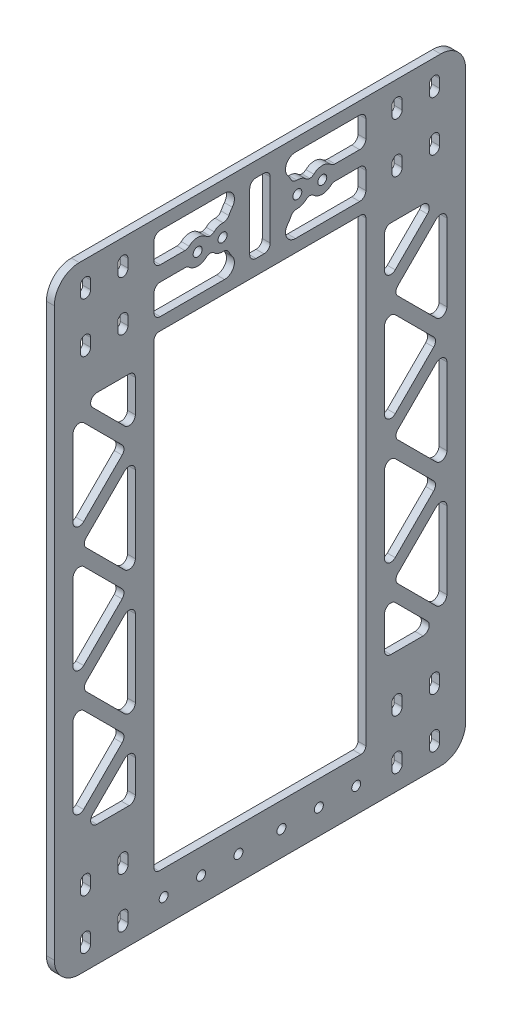
from build123d import *

# Parameters (mm, degrees)
BASE_FLANGE1_START         = -3.175
BASE_FLANGE1_OUTLINE_W     = 247.4
BASE_FLANGE1_OUTLINE_H     = 165
BASE_FLANGE1_OUTLINE_R     = 2.05
BASE_FLANGE1_OUTLINE_W_2   = 28
BASE_FLANGE1_OUTLINE_H_2   = 8.2
BASE_FLANGE1_DEPTH         = 3.175
FILLET1_R                  = 10
SLOTTED_CUTOUTS_DEPTH      = 149.721285044
SLOTTED_CUTOUTS_DEPTH_BACK = 149.721285044
SKETCH4_W                  = 85
SKETCH4_H                  = 187.4
CUT_EXTRUDE3_DEPTH         = 149.721285044
FILLET4_R                  = 2
FILLET3_R                  = 2.5
M3_CLEARANCE_HOLE1_D       = 3.6
FILLET8_R                  = 2.5


# Read off the part's stored shape, not the designer's step: Base-Flange1
with BuildPart() as part:
    # Base-Flange1 outline → Base-Flange1 (new body)
    with BuildSketch(Plane.YZ.offset(BASE_FLANGE1_START)):
        Rectangle(BASE_FLANGE1_OUTLINE_W, BASE_FLANGE1_OUTLINE_H)
        with Locations((-113.7, -70)):
            Circle(BASE_FLANGE1_OUTLINE_R, mode=Mode.SUBTRACT)
        with Locations((-93.7, -70)):
            Circle(BASE_FLANGE1_OUTLINE_R, mode=Mode.SUBTRACT)
        with Locations((-113.7, -55)):
            Circle(BASE_FLANGE1_OUTLINE_R, mode=Mode.SUBTRACT)
        with Locations((-93.7, -55)):
            Circle(BASE_FLANGE1_OUTLINE_R, mode=Mode.SUBTRACT)
        with Locations((93.7, -70)):
            Circle(BASE_FLANGE1_OUTLINE_R, mode=Mode.SUBTRACT)
        with Locations((113.7, -70)):
            Circle(BASE_FLANGE1_OUTLINE_R, mode=Mode.SUBTRACT)
        with Locations((93.7, -55)):
            Circle(BASE_FLANGE1_OUTLINE_R, mode=Mode.SUBTRACT)
        with Locations((113.7, -55)):
            Circle(BASE_FLANGE1_OUTLINE_R, mode=Mode.SUBTRACT)
        with Locations((-113.7, 55)):
            Circle(BASE_FLANGE1_OUTLINE_R, mode=Mode.SUBTRACT)
        with Locations((-93.7, 55)):
            Circle(BASE_FLANGE1_OUTLINE_R, mode=Mode.SUBTRACT)
        with Locations((-113.7, 70)):
            Circle(BASE_FLANGE1_OUTLINE_R, mode=Mode.SUBTRACT)
        with Locations((-93.7, 70)):
            Circle(BASE_FLANGE1_OUTLINE_R, mode=Mode.SUBTRACT)
        with Locations((103.7, 0)):
            Rectangle(BASE_FLANGE1_OUTLINE_W_2, BASE_FLANGE1_OUTLINE_H_2, mode=Mode.SUBTRACT)
        with Locations((93.7, 55)):
            Circle(BASE_FLANGE1_OUTLINE_R, mode=Mode.SUBTRACT)
        with Locations((113.7, 55)):
            Circle(BASE_FLANGE1_OUTLINE_R, mode=Mode.SUBTRACT)
        with Locations((93.7, 70)):
            Circle(BASE_FLANGE1_OUTLINE_R, mode=Mode.SUBTRACT)
        with Locations((113.7, 70)):
            Circle(BASE_FLANGE1_OUTLINE_R, mode=Mode.SUBTRACT)
    extrude(amount=BASE_FLANGE1_DEPTH)

    # Fillet1
    fillet1_edges = [part.edges().sort_by_distance(p)[0] for p in [
        (-1.5875, -123.7, -82.5),
        (-1.5875, -123.7, 82.5),
        (-1.5875, 123.7, 82.5),
        (-1.5875, 123.7, -82.5),
    ]]
    fillet(fillet1_edges, radius=FILLET1_R)

    # Sketch5 → Slotted Cutouts (cut, two sides: drawn at the far end of the back side and taken through both)
    with BuildSketch(Plane(origin=(0, 0, 0), x_dir=(0, 0, -1), z_dir=(1, 0, 0)).offset(-SLOTTED_CUTOUTS_DEPTH_BACK)):
        with BuildLine():
            Line((-72.05, 112), (-72.05, 115.4))
            ThreePointArc((-72.05, 115.4), (-70, 117.45), (-67.95, 115.4))
            Line((-67.95, 115.4), (-67.95, 112))
            ThreePointArc((-67.95, 112), (-70, 109.95), (-72.05, 112))
        make_face()
        with BuildLine():
            Line((-52.95, 112), (-52.95, 115.4))
            ThreePointArc((-52.95, 115.4), (-55, 117.45), (-57.05, 115.4))
            Line((-57.05, 115.4), (-57.05, 112))
            ThreePointArc((-57.05, 112), (-55, 109.95), (-52.95, 112))
        make_face()
        with BuildLine():
            Line((-72.05, 95.4), (-72.05, 92))
            ThreePointArc((-72.05, 92), (-70, 89.95), (-67.95, 92))
            Line((-67.95, 92), (-67.95, 95.4))
            ThreePointArc((-67.95, 95.4), (-70, 97.45), (-72.05, 95.4))
        make_face()
        with BuildLine():
            Line((-52.95, 95.4), (-52.95, 92))
            ThreePointArc((-52.95, 92), (-55, 89.95), (-57.05, 92))
            Line((-57.05, 92), (-57.05, 95.4))
            ThreePointArc((-57.05, 95.4), (-55, 97.45), (-52.95, 95.4))
        make_face()
        with BuildLine():
            Line((72.05, 112), (72.05, 115.4))
            ThreePointArc((72.05, 115.4), (70, 117.45), (67.95, 115.4))
            Line((67.95, 115.4), (67.95, 112))
            ThreePointArc((67.95, 112), (70, 109.95), (72.05, 112))
        make_face()
        with BuildLine():
            Line((52.95, 112), (52.95, 115.4))
            ThreePointArc((52.95, 115.4), (55, 117.45), (57.05, 115.4))
            Line((57.05, 115.4), (57.05, 112))
            ThreePointArc((57.05, 112), (55, 109.95), (52.95, 112))
        make_face()
        with BuildLine():
            Line((72.05, 95.4), (72.05, 92))
            ThreePointArc((72.05, 92), (70, 89.95), (67.95, 92))
            Line((67.95, 92), (67.95, 95.4))
            ThreePointArc((67.95, 95.4), (70, 97.45), (72.05, 95.4))
        make_face()
        with BuildLine():
            Line((52.95, 95.4), (52.95, 92))
            ThreePointArc((52.95, 92), (55, 89.95), (57.05, 92))
            Line((57.05, 92), (57.05, 95.4))
            ThreePointArc((57.05, 95.4), (55, 97.45), (52.95, 95.4))
        make_face()
        with BuildLine():
            Line((-72.05, -112), (-72.05, -115.4))
            ThreePointArc((-72.05, -115.4), (-70, -117.45), (-67.95, -115.4))
            Line((-67.95, -115.4), (-67.95, -112))
            ThreePointArc((-67.95, -112), (-70, -109.95), (-72.05, -112))
        make_face()
        with BuildLine():
            Line((-52.95, -112), (-52.95, -115.4))
            ThreePointArc((-52.95, -115.4), (-55, -117.45), (-57.05, -115.4))
            Line((-57.05, -115.4), (-57.05, -112))
            ThreePointArc((-57.05, -112), (-55, -109.95), (-52.95, -112))
        make_face()
        with BuildLine():
            Line((-72.05, -95.4), (-72.05, -92))
            ThreePointArc((-72.05, -92), (-70, -89.95), (-67.95, -92))
            Line((-67.95, -92), (-67.95, -95.4))
            ThreePointArc((-67.95, -95.4), (-70, -97.45), (-72.05, -95.4))
        make_face()
        with BuildLine():
            Line((-52.95, -95.4), (-52.95, -92))
            ThreePointArc((-52.95, -92), (-55, -89.95), (-57.05, -92))
            Line((-57.05, -92), (-57.05, -95.4))
            ThreePointArc((-57.05, -95.4), (-55, -97.45), (-52.95, -95.4))
        make_face()
        with BuildLine():
            Line((52.95, -112), (52.95, -115.4))
            ThreePointArc((52.95, -115.4), (55, -117.45), (57.05, -115.4))
            Line((57.05, -115.4), (57.05, -112))
            ThreePointArc((57.05, -112), (55, -109.95), (52.95, -112))
        make_face()
        with BuildLine():
            Line((72.05, -112), (72.05, -115.4))
            ThreePointArc((72.05, -115.4), (70, -117.45), (67.95, -115.4))
            Line((67.95, -115.4), (67.95, -112))
            ThreePointArc((67.95, -112), (70, -109.95), (72.05, -112))
        make_face()
        with BuildLine():
            Line((52.95, -95.4), (52.95, -92))
            ThreePointArc((52.95, -92), (55, -89.95), (57.05, -92))
            Line((57.05, -92), (57.05, -95.4))
            ThreePointArc((57.05, -95.4), (55, -97.45), (52.95, -95.4))
        make_face()
        with BuildLine():
            Line((72.05, -95.4), (72.05, -92))
            ThreePointArc((72.05, -92), (70, -89.95), (67.95, -92))
            Line((67.95, -92), (67.95, -95.4))
            ThreePointArc((67.95, -95.4), (70, -97.45), (72.05, -95.4))
        make_face()
    extrude(amount=SLOTTED_CUTOUTS_DEPTH + SLOTTED_CUTOUTS_DEPTH_BACK, mode=Mode.SUBTRACT)

    # Sketch4 → Cut-Extrude3 (cut, through all)
    with BuildSketch(Plane(origin=(0, 0, 0), x_dir=(0, 0, -1), z_dir=(1, 0, 0))):
        with BuildLine():
            ThreePointArc((14.247806849, 118.7), (10.657696977, 116.463834207), (11.081627549, 112.255555556))
            ThreePointArc((11.081627549, 112.255555556), (12.295687401, 110.394480662), (13.2, 108.364761516))
            ThreePointArc((13.2, 108.364761516), (16.379441092, 108.505948634), (19, 106.7))
            Line((19, 106.7), (21, 106.7))
            ThreePointArc((21, 106.7), (25, 108.7), (29, 106.7))
            Line((29, 106.7), (42.5, 106.7))
            Line((42.5, 106.7), (42.5, 118.7))
            Line((42.5, 118.7), (14.247806849, 118.7))
        make_face()
        with BuildLine():
            ThreePointArc((-13.2, 108.364761516), (-12.295687401, 110.394480662), (-11.081627549, 112.255555556))
            ThreePointArc((-11.081627549, 112.255555556), (-10.657696977, 116.463834207), (-14.247806849, 118.7))
            Line((-14.247806849, 118.7), (-42.5, 118.7))
            Line((-42.5, 118.7), (-42.5, 106.7))
            Line((-42.5, 106.7), (-29, 106.7))
            ThreePointArc((-29, 106.7), (-25, 108.7), (-21, 106.7))
            Line((-21, 106.7), (-19, 106.7))
            ThreePointArc((-19, 106.7), (-16.379441092, 108.505948634), (-13.2, 108.364761516))
        make_face()
        with BuildLine():
            ThreePointArc((-14.247806849, 88.7), (-10.657696977, 90.936165793), (-11.081627549, 95.144444444))
            ThreePointArc((-11.081627549, 95.144444444), (-12.295687401, 97.005519338), (-13.2, 99.035238484))
            ThreePointArc((-13.2, 99.035238484), (-16.379441092, 98.894051366), (-19, 100.7))
            Line((-19, 100.7), (-21, 100.7))
            ThreePointArc((-21, 100.7), (-25, 98.7), (-29, 100.7))
            Line((-29, 100.7), (-42.5, 100.7))
            Line((-42.5, 100.7), (-42.5, 88.7))
            Line((-42.5, 88.7), (-14.247806849, 88.7))
        make_face()
        with BuildLine():
            ThreePointArc((13.2, 99.035238484), (12.295687401, 97.005519338), (11.081627549, 95.144444444))
            ThreePointArc((11.081627549, 95.144444444), (10.657696977, 90.936165793), (14.247806849, 88.7))
            Line((14.247806849, 88.7), (42.5, 88.7))
            Line((42.5, 88.7), (42.5, 100.7))
            Line((42.5, 100.7), (29, 100.7))
            ThreePointArc((29, 100.7), (25, 98.7), (21, 100.7))
            Line((21, 100.7), (19, 100.7))
            ThreePointArc((19, 100.7), (16.379441092, 98.894051366), (13.2, 99.035238484))
        make_face()
        with Locations((0, -10)):
            Rectangle(SKETCH4_W, SKETCH4_H)
        Polygon((-75, -28.535533906), (-75, -71.464466094), (-53.535533906, -50), align=None)
        Polygon((-50, -53.535533906), (-71.464466094, -75), (-50, -75), align=None)
        Polygon((-71.464466094, -25), (-50, -46.464466094), (-50, -3.535533906), align=None)
        Polygon((-75, 21.464466094), (-75, -21.464466094), (-53.535533906, 0), align=None)
        Polygon((-71.464466094, 25), (-50, 3.535533906), (-50, 46.464466094), align=None)
        Polygon((-75, 71.464466094), (-75, 28.535533906), (-53.535533906, 50), align=None)
        Polygon((-71.464466094, 75), (-50, 53.535533906), (-50, 75), align=None)
        Polygon((75, 71.464466094), (53.535533906, 50), (75, 28.535533906), align=None)
        Polygon((50, 53.535533906), (71.464466094, 75), (50, 75), align=None)
        Polygon((75, -21.464466094), (75, 21.464466094), (53.535533906, 0), align=None)
        Polygon((71.464466094, 25), (50, 46.464466094), (50, 3.535533906), align=None)
        Polygon((71.464466094, -25), (50, -3.535533906), (50, -46.464466094), align=None)
        Polygon((75, -71.464466094), (75, -28.535533906), (53.535533906, -50), align=None)
        Polygon((71.464466094, -75), (50, -53.535533906), (50, -75), align=None)
    extrude(amount=-CUT_EXTRUDE3_DEPTH, mode=Mode.SUBTRACT)

    # Fillet4
    fillet4_edges = [part.edges().sort_by_distance(p)[0] for p in [
        (-1.5875, -103.7, -42.5),
        (-1.5875, -103.7, 42.5),
        (-1.5875, 83.7, 42.5),
        (-1.5875, 83.7, -42.5),
    ]]
    fillet(fillet4_edges, radius=FILLET4_R)

    # Fillet3
    # the kernel refuses this fillet: 2.5 mm, written as the material it adds along each edge
    with BuildSketch(Plane(origin=(0, 75, -71.464466094), x_dir=(0, -0.7071067811865476, 0.7071067811865476), z_dir=(-1, 0, 0)), Plane(origin=(0, 46.464466094, 50), x_dir=(0, -1, 0), z_dir=(-1, 0, 0)), Plane(origin=(0, 3.535533906, 50), x_dir=(0, 0.7071067811865478, 0.7071067811865471), z_dir=(-1, 0, 0)), Plane(origin=(0, 46.464466094, -50), x_dir=(0, -0.7071067811865476, -0.7071067811865476), z_dir=(-1, 0, 0)), Plane(origin=(0, 28.535533906, -75), x_dir=(0, 0.7071067811865476, 0.7071067811865476), z_dir=(-1, 0, 0)), Plane(origin=(0, -28.535533906, -75), x_dir=(0, -1, 0), z_dir=(-1, 0, 0)), Plane(origin=(0, -3.535533906, -50), x_dir=(0, -0.7071067811865468, -0.7071067811865482), z_dir=(-1, 0, 0)), Plane(origin=(0, -71.464466094, 75), x_dir=(0, 1, 0), z_dir=(-1, 0, 0)), Plane(origin=(0, -46.464466094, 50), x_dir=(0, 0.7071067811865476, 0.7071067811865476), z_dir=(-1, 0, 0)), Plane(origin=(0, -75, 71.464466094), x_dir=(0, 0.7071067811865476, -0.7071067811865476), z_dir=(-1, 0, 0)), Plane(origin=(0, -21.464466094, 75), x_dir=(0, 1, 0), z_dir=(-1, 0, 0)), Plane(origin=(0, 53.535533906, 50), x_dir=(0, 0.7071067811865476, 0.7071067811865476), z_dir=(-1, 0, 0)), Plane(origin=(0, 28.535533906, 75), x_dir=(0, 1, 0), z_dir=(-1, 0, 0)), Plane(origin=(0, -53.535533906, -50), x_dir=(0, -0.7071067811865469, -0.707106781186548), z_dir=(-1, 0, 0)), Plane(origin=(0, 21.464466094, -75), x_dir=(0, -1, 0), z_dir=(-1, 0, 0))) as fillet3_piece_1:
        with BuildLine():
            CenterArc((FILLET3_R * 2.41421356237, FILLET3_R), FILLET3_R, 135, 135)
            Line((FILLET3_R * 1.70710678119, FILLET3_R * 1.70710678119), (0, 0))
            Line((0, 0), (FILLET3_R * 2.41421356237, 0))
        make_face()
    extrude(amount=3.175)
    with BuildSketch(Plane(origin=(0, 53.535533906, -50), x_dir=(0, 0.7071067811865476, -0.7071067811865476), z_dir=(-1, 0, 0)), Plane(origin=(0, 3.535533906, -50), x_dir=(0, 0.7071067811865485, -0.7071067811865466), z_dir=(-1, 0, 0)), Plane(origin=(0, 71.464466094, -75), x_dir=(0, -0.7071067811865476, 0.7071067811865476), z_dir=(-1, 0, 0)), Plane(origin=(0, -71.464466094, -75), x_dir=(0, 1, 0), z_dir=(-1, 0, 0)), Plane(origin=(0, -46.464466094, -50), x_dir=(0, 0.7071067811865464, -0.7071067811865487), z_dir=(-1, 0, 0)), Plane(origin=(0, -28.535533906, 75), x_dir=(0, -1, 0), z_dir=(-1, 0, 0)), Plane(origin=(0, -3.535533906, 50), x_dir=(0, -0.7071067811865471, 0.707106781186548), z_dir=(-1, 0, 0)), Plane(origin=(0, -53.535533906, 50), x_dir=(0, -0.7071067811865469, 0.707106781186548), z_dir=(-1, 0, 0)), Plane(origin=(0, 21.464466094, 75), x_dir=(0, -1, 0), z_dir=(-1, 0, 0)), Plane(origin=(0, 75, 71.464466094), x_dir=(0, -0.7071067811865476, -0.7071067811865476), z_dir=(-1, 0, 0)), Plane(origin=(0, 71.464466094, 75), x_dir=(0, -1, 0), z_dir=(-1, 0, 0)), Plane(origin=(0, -75, -71.464466094), x_dir=(0, 0.7071067811865476, 0.7071067811865476), z_dir=(-1, 0, 0)), Plane(origin=(0, -21.464466094, -75), x_dir=(0, 1, 0), z_dir=(-1, 0, 0))) as fillet3_piece_2:
        with BuildLine():
            CenterArc((FILLET3_R * 2.41421356237, -FILLET3_R), FILLET3_R, 90, 135)
            Line((FILLET3_R * 1.70710678119, -FILLET3_R * 1.70710678119), (0, 0))
            Line((0, 0), (FILLET3_R * 2.41421356237, 0))
        make_face()
    extrude(amount=3.175)
    with BuildSketch(Plane(origin=(0, 75, -50), x_dir=(0, 0, -1), z_dir=(-1, 0, 0)), Plane(origin=(0, 118.7, -42.5), x_dir=(0, -1, 0), z_dir=(-1, 0, 0)), Plane(origin=(0, 100.7, -42.5), x_dir=(0, -1, 0), z_dir=(-1, 0, 0)), Plane(origin=(0, 88.7, -42.5), x_dir=(0, 0, 1), z_dir=(-1, 0, 0)), Plane(origin=(0, 25, -71.464466094), x_dir=(0, -0.7071067811865482, 0.7071067811865468), z_dir=(-1, 0, 0)), Plane(origin=(0, 50, -53.535533906), x_dir=(0, 0.7071067811865476, -0.7071067811865476), z_dir=(-1, 0, 0)), Plane(origin=(0, -50, -53.535533906), x_dir=(0, 0.7071067811865476, -0.7071067811865476), z_dir=(-1, 0, 0)), Plane(origin=(0, -25, -71.464466094), x_dir=(0, -0.7071067811865476, 0.7071067811865476), z_dir=(-1, 0, 0)), Plane(origin=(0, -50, 53.535533906), x_dir=(0, -0.7071067811865475, 0.7071067811865475), z_dir=(-1, 0, 0)), Plane(origin=(0, -25, 71.464466094), x_dir=(0, 0.7071067811865461, -0.7071067811865489), z_dir=(-1, 0, 0)), Plane(origin=(0, -75, 50), x_dir=(0, 0, 1), z_dir=(-1, 0, 0)), Plane(origin=(0, 0, 53.535533906), x_dir=(0, -0.7071067811865477, 0.7071067811865476), z_dir=(-1, 0, 0)), Plane(origin=(0, 75, 50), x_dir=(0, -1, 0), z_dir=(-1, 0, 0)), Plane(origin=(0, 50, 53.535533906), x_dir=(0, -0.7071067811865476, 0.7071067811865476), z_dir=(-1, 0, 0)), Plane(origin=(0, 106.7, 42.5), x_dir=(0, 1, 0), z_dir=(-1, 0, 0)), Plane(origin=(0, 118.7, 42.5), x_dir=(0, 0, -1), z_dir=(-1, 0, 0)), Plane(origin=(0, 100.7, 42.5), x_dir=(0, 0, -1), z_dir=(-1, 0, 0)), Plane(origin=(0, -75, -50), x_dir=(0, 1, 0), z_dir=(-1, 0, 0)), Plane(origin=(0, 0, -53.535533906), x_dir=(0, 0.7071067811865476, -0.7071067811865476), z_dir=(-1, 0, 0))) as fillet3_piece_3:
        with BuildLine():
            CenterArc((FILLET3_R, FILLET3_R), FILLET3_R, 180, 90)
            Line((0, FILLET3_R), (0, 0))
            Line((0, 0), (FILLET3_R, 0))
        make_face()
    extrude(amount=3.175)
    with BuildSketch(Plane(origin=(0, 106.7, -21), x_dir=(0, 0, 1), z_dir=(-1, 0, 0)), Plane(origin=(0, 100.7, -29), x_dir=(0, 0, -1), z_dir=(-1, 0, 0)), Plane(origin=(0, 100.7, -19), x_dir=(0, 0, -1), z_dir=(-1, 0, 0)), Plane(origin=(0, 106.7, 19), x_dir=(0, 0, 1), z_dir=(-1, 0, 0)), Plane(origin=(0, 106.7, 29), x_dir=(0, 0, 1), z_dir=(-1, 0, 0)), Plane(origin=(0, 100.7, 21), x_dir=(0, 0, -1), z_dir=(-1, 0, 0))) as fillet3_piece_4:
        with BuildLine():
            CenterArc((1.099019514, 2.5), FILLET3_R, 227.166571934, 42.833428066)
            ThreePointArc((-0.600653658, 0.666666667), (-0.285340839, 0.346835418), (0, 0))
            Line((0, 0), (1.099019514, 0))
        make_face()
    extrude(amount=3.175)
    with BuildSketch(Plane(origin=(0, 106.7, -19), x_dir=(0, 0.742931832264306, 0.66936708360092), z_dir=(-1, 0, 0)), Plane(origin=(0, 106.7, -29), x_dir=(0, 0.7429318322643071, 0.6693670836009186), z_dir=(-1, 0, 0)), Plane(origin=(0, 100.7, -21), x_dir=(0, -0.7429318322642994, -0.6693670836009273), z_dir=(-1, 0, 0)), Plane(origin=(0, 106.7, 21), x_dir=(0, 0.7429318322643014, 0.6693670836009251), z_dir=(-1, 0, 0)), Plane(origin=(0, 100.7, 29), x_dir=(0, -0.7429318322643466, -0.6693670836008749), z_dir=(-1, 0, 0)), Plane(origin=(0, 100.7, 19), x_dir=(0, -0.7429318322643071, -0.6693670836009186), z_dir=(-1, 0, 0))) as fillet3_piece_5:
        with BuildLine():
            CenterArc((1.121682094, 2.48991429), FILLET3_R, 222.01823479, 42.833428066)
            Line((-0.735647487, 0.816496581), (0, 0))
            ThreePointArc((0, 0), (0.448672838, 0.02017142), (0.897345675, 0))
        make_face()
    extrude(amount=3.175)
    with BuildSketch(Plane(origin=(0, 108.364761516, -13.2), x_dir=(0, 0.9188764648119495, 0.3945453616692181), z_dir=(-1, 0, 0)), Plane(origin=(0, 99.035238484, 13.2), x_dir=(0, -0.9188764648119468, -0.39454536166922416), z_dir=(-1, 0, 0))) as fillet3_piece_6:
        with BuildLine():
            CenterArc((2.007900407, 2.494576671), FILLET3_R, 200.945179677, 65.280148817)
            ThreePointArc((-0.326906803, 1.600890319), (-0.097617568, 0.813889043), (0, 0))
            ThreePointArc((0, 0), (0.921659203, 0.030370645), (1.843318406, 0))
        make_face()
    extrude(amount=3.175)
    with BuildSketch(Plane(origin=(0, 106.7, -42.5), x_dir=(0, 1, 0), z_dir=(-1, 0, 0)), Plane(origin=(0, 25, 71.464466094), x_dir=(0, -0.7071067811865476, -0.7071067811865476), z_dir=(-1, 0, 0)), Plane(origin=(0, 88.7, 42.5), x_dir=(0, 0, -1), z_dir=(-1, 0, 0))) as fillet3_piece_7:
        with BuildLine():
            CenterArc((FILLET3_R, -FILLET3_R), FILLET3_R, 90, 90)
            Line((0, -FILLET3_R), (0, 0))
            Line((0, 0), (FILLET3_R, 0))
        make_face()
    extrude(amount=3.175)
    with BuildSketch(Plane(origin=(0, 99.035238484, -13.2), x_dir=(0, -0.20272439104741638, -0.979235835370854), z_dir=(-1, 0, 0)), Plane(origin=(0, 108.364761516, 13.2), x_dir=(0, 0.20272439104742493, 0.9792358353708522), z_dir=(-1, 0, 0))) as fillet3_piece_8:
        with BuildLine():
            CenterArc((2.042408915, 2.466402772), FILLET3_R, 195.315974559, 65.280148817)
            ThreePointArc((-0.368800612, 1.806047855), (-0.154643733, 0.909100313), (0, 0))
            ThreePointArc((0, 0), (0.816963566, 0.067194456), (1.633927132, 0))
        make_face()
    extrude(amount=3.175)

    # M3 Clearance Hole1 (through all)
    with Locations(Plane(origin=(0, 0, 0), x_dir=(0, 0, -1), z_dir=(1, 0, 0))):
        with Locations((-23.625, -113.7), (-38.625, -113.7), (-8.625, -113.7), (-15, 103.7), (-25, 103.7)):
            m3_clearance_hole1 = Hole(M3_CLEARANCE_HOLE1_D / 2)

    # Mirror1: M3 Clearance Hole1 across plane
    add(m3_clearance_hole1.mirror(Plane.XY), mode=Mode.SUBTRACT)

    # Fillet8
    fillet8_edges = [part.edges().sort_by_distance(p)[0] for p in [
        (-1.5875, 117.7, -4.1),
        (-1.5875, 89.7, -4.1),
        (-1.5875, 89.7, 4.1),
        (-1.5875, 117.7, 4.1),
    ]]
    fillet(fillet8_edges, radius=FILLET8_R)


solid = part.part
